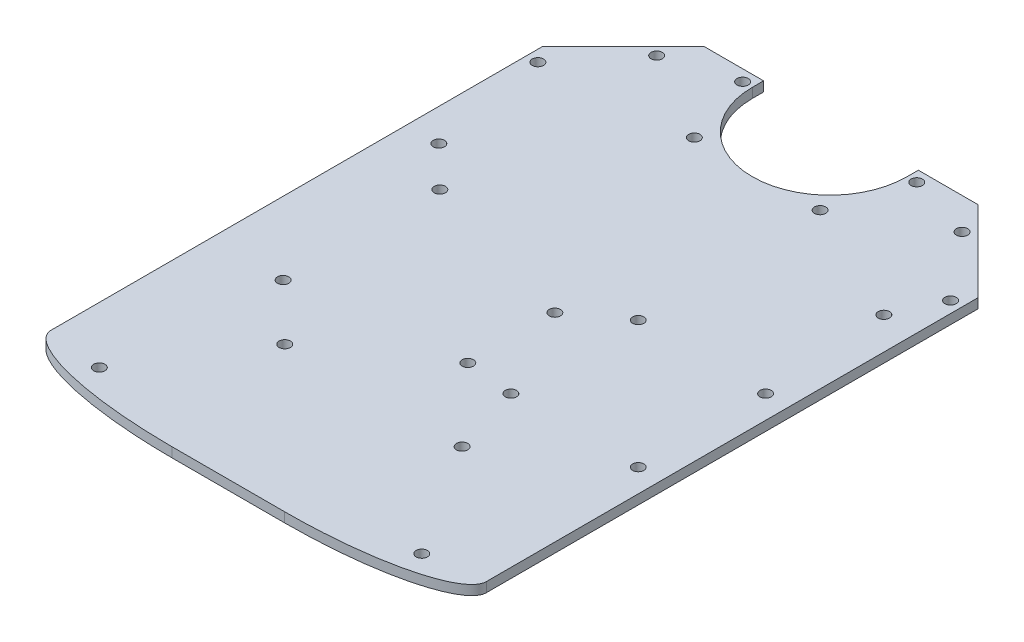
from build123d import *

# Parameters (mm, degrees)
SKETCH2_W           = 135
SKETCH2_H           = 190
BOSS_EXTRUDE2_DEPTH = 3
SKETCH3_R           = 1.75
CUT_EXTRUDE1_DEPTH  = 117.577227622
FILLET1_SIZE        = 12.5
FILLET1_SIZE_2      = 50
FILLET2_SIZE        = 12.5
FILLET2_SIZE_2      = 50
CHAMFER2_SIZE       = 25
CHAMFER3_SIZE       = 25
CUT_EXTRUDE5_DEPTH  = 117.577227764
SKETCH8_R           = 1.75
CUT_EXTRUDE6_DEPTH  = 117.577227764
SKETCH11_R          = 1.75
CUT_EXTRUDE8_DEPTH  = 117.577227764
SKETCH12_R          = 1.75
CUT_EXTRUDE9_DEPTH  = 117.577227764
SKETCH18_R          = 1.75
CUT_EXTRUDE10_DEPTH = 117.577227764
SKETCH19_R          = 1.75
CUT_EXTRUDE11_DEPTH = 117.577227764
SKETCH20_R          = 1.75
CUT_EXTRUDE12_DEPTH = 10


with BuildPart() as part:
    # Sketch2 → Boss-Extrude2 (new body)
    with BuildSketch(Plane(origin=(0, 0, 0), x_dir=(1, 0, 0), z_dir=(0, 1, 0))):
        Rectangle(SKETCH2_W, SKETCH2_H)
    extrude(amount=BOSS_EXTRUDE2_DEPTH)

    # Sketch3 → Cut-Extrude1 (cut, through all)
    with BuildSketch(Plane(origin=(0, 3, 0), x_dir=(1, 0, 0), z_dir=(0, 1, 0))):
        with Locations(Location((-27.5, -50, 0), (0, 0, 270))):
            Circle(SKETCH3_R)
        with Locations(Location((27.5, -50, 0), (0, 0, 90))):
            Circle(SKETCH3_R)
        with Locations(Location((-50, -85, 0), (0, 0, 270))):
            Circle(SKETCH3_R)
        with Locations(Location((50, -85, 0), (0, 0, 90))):
            Circle(SKETCH3_R)
    extrude(amount=-CUT_EXTRUDE1_DEPTH, mode=Mode.SUBTRACT)

    # Fillet1
    # an asymmetric fillet: 50, 12.5 mm, written as the material it takes off along each edge
    with BuildSketch(Plane(origin=(-67.5, -125, 95), x_dir=(0, 0, -1), z_dir=(0, 1, 0))) as fillet1_piece_1:
        with BuildLine():
            Bezier((FILLET1_SIZE, 0), (0, 0), (0, -FILLET1_SIZE_2), weights=[1, 0.707106781, 1])
            Line((0, -FILLET1_SIZE_2), (0, 0))
            Line((0, 0), (FILLET1_SIZE, 0))
        make_face()
    extrude(amount=253, mode=Mode.SUBTRACT)

    # Fillet2
    # an asymmetric fillet: 50, 12.5 mm, written as the material it takes off along each edge
    with BuildSketch(Plane(origin=(67.5, -125, 95), x_dir=(0, 0, -1), z_dir=(0, 1, 0))) as fillet2_piece_1:
        with BuildLine():
            Bezier((FILLET2_SIZE, 0), (0, 0), (0, FILLET2_SIZE_2), weights=[1, 0.707106781, 1])
            Line((0, FILLET2_SIZE_2), (0, 0))
            Line((0, 0), (FILLET2_SIZE, 0))
        make_face()
    extrude(amount=253, mode=Mode.SUBTRACT)

    # Chamfer2
    chamfer2_edges = [part.edges().sort_by_distance(p)[0] for p in [
        (67.5, 1.5, -95),
    ]]
    chamfer(chamfer2_edges, length=CHAMFER2_SIZE)

    # Chamfer3
    chamfer3_edges = [part.edges().sort_by_distance(p)[0] for p in [
        (-67.5, 1.5, -95),
    ]]
    chamfer(chamfer3_edges, length=CHAMFER3_SIZE)

    # Sketch7 → Cut-Extrude5 (cut, through all)
    with BuildSketch(Plane(origin=(0, 3, 0), x_dir=(1, 0, 0), z_dir=(0, 1, 0))):
        with BuildLine():
            Line((24, 91.5), (24, 95))
            Line((24, 95), (-24, 95))
            Line((-24, 95), (-24, 91.5))
            ThreePointArc((-24, 91.5), (0, 67.5), (24, 91.5))
        make_face()
    extrude(amount=-CUT_EXTRUDE5_DEPTH, mode=Mode.SUBTRACT)

    # Sketch8 → Cut-Extrude6 (cut, through all)
    with BuildSketch(Plane(origin=(0, 3, 0), x_dir=(1, 0, 0), z_dir=(0, 1, 0))):
        with Locations(Location((-27, 91.5, 0), (0, 0, 270))):
            Circle(SKETCH8_R)
        with Locations(Location((27, 91.5, 0), (0, 0, 270))):
            Circle(SKETCH8_R)
    extrude(amount=-CUT_EXTRUDE6_DEPTH, mode=Mode.SUBTRACT)

    # Sketch11 → Cut-Extrude8 (cut, through all)
    with BuildSketch(Plane(origin=(0, 3, 0), x_dir=(1, 0, 0), z_dir=(0, 1, 0))):
        with Locations(Location((47.347456736, 85.202795796, 0), (0, 0, 270))):
            Circle(SKETCH11_R)
        with Locations(Location((64, 65, 0), (0, 0, 270))):
            Circle(SKETCH11_R)
        with Locations(Location((-64, 65, 0), (0, 0, 270))):
            Circle(SKETCH11_R)
        with Locations(Location((-47.347456736, 85.202795796, 0), (0, 0, 270))):
            Circle(SKETCH11_R)
    extrude(amount=-CUT_EXTRUDE8_DEPTH, mode=Mode.SUBTRACT)

    # Sketch12 → Cut-Extrude9 (cut, through all)
    with BuildSketch(Plane(origin=(0, 0, 0), x_dir=(-1, 0, 0), z_dir=(0, -1, 0))):
        with Locations(Location((45, -33, 0), (0, 0, 90))):
            Circle(SKETCH12_R)
        with Locations(Location((-5.9, -26.63, 0), (0, 0, 90))):
            Circle(SKETCH12_R)
        with Locations(Location((45, 15.6, 0), (0, 0, 90))):
            Circle(SKETCH12_R)
        with Locations(Location((-5.9, 0.37, 0), (0, 0, 90))):
            Circle(SKETCH12_R)
    extrude(amount=-CUT_EXTRUDE9_DEPTH, mode=Mode.SUBTRACT)

    # Sketch18 → Cut-Extrude10 (cut, through all)
    with BuildSketch(Plane(origin=(0, 3, 0), x_dir=(1, 0, 0), z_dir=(0, 1, 0))):
        with Locations(Location((20.83, -28.2, 0), (0, 0, 270))):
            Circle(SKETCH18_R)
        with Locations(Location((20.83, 11.3, 0), (0, 0, 270))):
            Circle(SKETCH18_R)
        with Locations(Location((60.33, 11.3, 0), (0, 0, 270))):
            Circle(SKETCH18_R)
        with Locations(Location((60.33, -28.2, 0), (0, 0, 270))):
            Circle(SKETCH18_R)
    extrude(amount=-CUT_EXTRUDE10_DEPTH, mode=Mode.SUBTRACT)

    # Sketch19 → Cut-Extrude11 (cut, through all)
    with BuildSketch(Plane(origin=(0, 3, 0), x_dir=(1, 0, 0), z_dir=(0, 1, 0))):
        with Locations(Location((57.5, 50.8, 0), (0, 0, 270))):
            Circle(SKETCH19_R)
        with Locations(Location((-57.5, 27.8, 0), (0, 0, 270))):
            Circle(SKETCH19_R)
    extrude(amount=-CUT_EXTRUDE11_DEPTH, mode=Mode.SUBTRACT)

    # Sketch20 → Cut-Extrude12 (cut)
    with BuildSketch(Plane(origin=(0, 0, 0), x_dir=(-1, 0, 0), z_dir=(0, -1, 0))):
        with Locations(Location((19.5, 69.019658785, 0), (0, 0, 90))):
            Circle(SKETCH20_R)
        with Locations(Location((-19.5, 69.019658785, 0), (0, 0, 90))):
            Circle(SKETCH20_R)
    extrude(amount=-CUT_EXTRUDE12_DEPTH, mode=Mode.SUBTRACT)


solid = part.part
